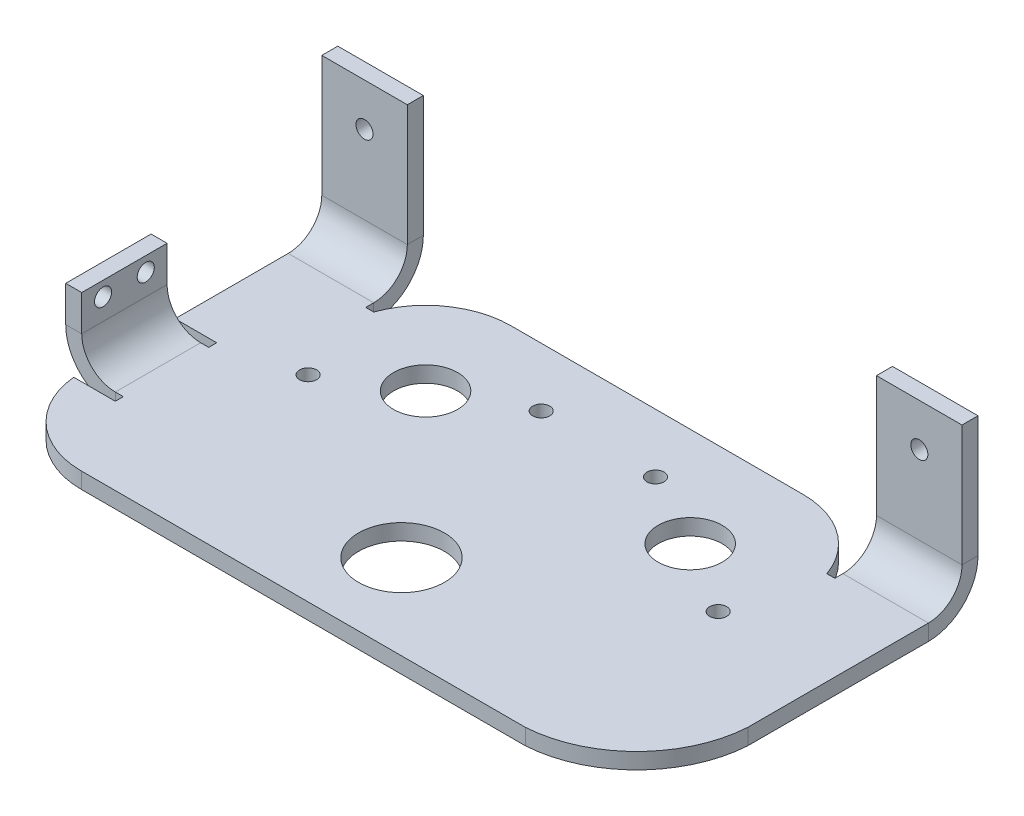
from build123d import *

# Parameters (mm, degrees)
SKETCH1_W                     = 190.5
SKETCH1_H                     = 101.6
BOSS_EXTRUDE1_DEPTH           = 1.5875
CONVERT_SOLID1_START          = -95.25
CONVERT_SOLID1_OUTLINE_W      = 3.175
CONVERT_SOLID1_OUTLINE_H      = 101.6
CONVERT_SOLID1_DEPTH          = 190.5
SKETCH30_R                    = 12.770921212
CUT_EXTRUDE6_DEPTH            = 38.1
SKETCH35_W                    = 139.601875342
SKETCH35_H                    = 6.35
CUT_EXTRUDE7_DEPTH            = 0.254
EDGE_FLANGE1_STRIP_W          = 39.05
EDGE_FLANGE1_STRIP_H          = 4.7625
EDGE_FLANGE1_STRIP_CUT_DEPTH  = 25.449062329
EDGE_FLANGE1_RELIEF_W         = 41.43125
EDGE_FLANGE1_RELIEF_H         = 2.38125
EDGE_FLANGE1_RELIEF_CUT_DEPTH = 4.7625
EDGE_FLANGE1_DEPTH            = 25.449062329
EDGE_FLANGE2_STRIP_W          = 39.05
EDGE_FLANGE2_STRIP_H          = 4.7625
EDGE_FLANGE2_STRIP_CUT_DEPTH  = 25.449062329
EDGE_FLANGE2_RELIEF_W         = 41.43125
EDGE_FLANGE2_RELIEF_H         = 2.38125
EDGE_FLANGE2_RELIEF_CUT_DEPTH = 4.7625
EDGE_FLANGE2_DEPTH            = 25.449062329
SKETCH45_W                    = 4.7625
SKETCH45_H                    = 0.000254
CUT_EXTRUDE10_DEPTH           = 25.4
EDGE_FLANGE4_STRIP_W          = 39.05
EDGE_FLANGE4_STRIP_H          = 4.7625
EDGE_FLANGE4_STRIP_CUT_DEPTH  = 25.4
EDGE_FLANGE4_RELIEF_W         = 41.43125
EDGE_FLANGE4_RELIEF_H         = 2.38125
EDGE_FLANGE4_RELIEF_CUT_DEPTH = 4.7625
EDGE_FLANGE4_DEPTH            = 25.4
FILLET9_R                     = 25.4
CUT_EXTRUDE11_DEPTH           = 25.4
FILLET10_R                    = 25.4
SKETCH53_R                    = 2.54
CUT_EXTRUDE12_DEPTH           = 4.7625
SKETCH54_R                    = 2.54
CUT_EXTRUDE13_DEPTH           = 4.7625
SKETCH55_R                    = 9.525
SKETCH55_R_2                  = 2.54
CUT_EXTRUDE14_DEPTH           = 4.7625


# Read off the part's stored shape, not the designer's step: Convert-Solid1
# Sheet-metal steps are written as plain solids
with BuildPart() as part:
    # Sketch1 → Boss-Extrude1 (new body)
    with BuildSketch(Plane(origin=(0, 0, 0), x_dir=(1, 0, 0), z_dir=(0, 1, 0))):
        Rectangle(SKETCH1_W, SKETCH1_H)
    extrude(amount=BOSS_EXTRUDE1_DEPTH)

    # Convert-Solid1 outline → Convert-Solid1 (add)
    with BuildSketch(Plane.YZ.offset(CONVERT_SOLID1_START)):
        with Locations((-1.5875, 0)):
            Rectangle(CONVERT_SOLID1_OUTLINE_W, CONVERT_SOLID1_OUTLINE_H)
    extrude(amount=CONVERT_SOLID1_DEPTH)

    # Sketch30 → Cut-Extrude6 (cut)
    with BuildSketch(Plane(origin=(0, -3.175, 0), x_dir=(-1, 0, 0), z_dir=(0, -1, 0))):
        with Locations(Location((0, -25.504506424, 0), (0, 0, 90))):
            Circle(SKETCH30_R)
    extrude(amount=-CUT_EXTRUDE6_DEPTH, mode=Mode.SUBTRACT)

    # Sketch35 → Cut-Extrude7 (cut)
    with BuildSketch(Plane(origin=(0, 0, -50.8), x_dir=(-1, 0, 0), z_dir=(0, 0, -1))):
        Rectangle(SKETCH35_W, SKETCH35_H)
    extrude(amount=-CUT_EXTRUDE7_DEPTH, mode=Mode.SUBTRACT)

    # Edge-Flange1 strip (across the edge) → Edge-Flange1 strip cut (cut)
    with BuildSketch(Plane(origin=(95.25, 1.5875, -50.8), x_dir=(0, 0, 1), z_dir=(-1, 0, 0))):
        with Locations((-4.7625, -2.38125)):
            Rectangle(EDGE_FLANGE1_STRIP_W, EDGE_FLANGE1_STRIP_H)
    extrude(amount=EDGE_FLANGE1_STRIP_CUT_DEPTH, mode=Mode.SUBTRACT)

    # Edge-Flange1 relief (on the sheet) → Edge-Flange1 relief cut (cut)
    with BuildSketch(Plane(origin=(95.25, 1.5875, -36.0375), x_dir=(0, 0, 1), z_dir=(0, 1, 0))):
        with Locations((-18.334375, -26.639687329)):
            Rectangle(EDGE_FLANGE1_RELIEF_W, EDGE_FLANGE1_RELIEF_H)
    extrude(amount=-EDGE_FLANGE1_RELIEF_CUT_DEPTH, mode=Mode.SUBTRACT)

    # Edge-Flange1 section (across the edge) → Edge-Flange1 (add)
    with BuildSketch(Plane(origin=(95.25, 1.5875, -50.8), x_dir=(0, 0, 1), z_dir=(-1, 0, 0))):
        with BuildLine():
            Line((0, 10), (0, 46.0375))
            Line((0, 46.0375), (4.7625, 46.0375))
            Line((4.7625, 46.0375), (4.7625, 10))
            ThreePointArc((4.7625, 10), (7.691432188, 2.928932188), (14.7625, 0))
            Line((14.7625, 0), (14.7625, -4.7625))
            ThreePointArc((14.7625, -4.7625), (4.323836143, -0.438663857), (0, 10))
        make_face()
    extrude(amount=EDGE_FLANGE1_DEPTH)

    # Edge-Flange2 strip (across the edge) → Edge-Flange2 strip cut (cut)
    with BuildSketch(Plane(origin=(-69.800937671, 1.5875, -50.8), x_dir=(0, 0, 1), z_dir=(-1, 0, 0))):
        with Locations((-4.7625, -2.38125)):
            Rectangle(EDGE_FLANGE2_STRIP_W, EDGE_FLANGE2_STRIP_H)
    extrude(amount=EDGE_FLANGE2_STRIP_CUT_DEPTH, mode=Mode.SUBTRACT)

    # Edge-Flange2 relief (on the sheet) → Edge-Flange2 relief cut (cut)
    with BuildSketch(Plane(origin=(-69.800937671, 1.5875, -36.0375), x_dir=(0, 0, 1), z_dir=(0, 1, 0))):
        with Locations((-18.334375, 1.190625)):
            Rectangle(EDGE_FLANGE2_RELIEF_W, EDGE_FLANGE2_RELIEF_H)
    extrude(amount=-EDGE_FLANGE2_RELIEF_CUT_DEPTH, mode=Mode.SUBTRACT)

    # Edge-Flange2 section (across the edge) → Edge-Flange2 (add)
    with BuildSketch(Plane(origin=(-69.800937671, 1.5875, -50.8), x_dir=(0, 0, 1), z_dir=(-1, 0, 0))):
        with BuildLine():
            Line((0, 10), (0, 46.0375))
            Line((0, 46.0375), (4.7625, 46.0375))
            Line((4.7625, 46.0375), (4.7625, 10))
            ThreePointArc((4.7625, 10), (7.691432188, 2.928932188), (14.7625, 0))
            Line((14.7625, 0), (14.7625, -4.7625))
            ThreePointArc((14.7625, -4.7625), (4.323836143, -0.438663857), (0, 10))
        make_face()
    extrude(amount=EDGE_FLANGE2_DEPTH)

    # Sketch45 → Cut-Extrude10 (cut)
    with BuildSketch(Plane(origin=(0, 1.5875, 0), x_dir=(1, 0, 0), z_dir=(0, 1, 0))):
        with Locations((-92.86875, -25.399873)):
            Rectangle(SKETCH45_W, SKETCH45_H)
        with Locations((-92.86875, 0.000381)):
            Rectangle(SKETCH45_W, SKETCH45_H)
    extrude(amount=-CUT_EXTRUDE10_DEPTH, mode=Mode.SUBTRACT)

    # Edge-Flange4 strip (across the edge) → Edge-Flange4 strip cut (cut)
    with BuildSketch(Plane(origin=(-95.25, 1.5875, -0.000254), x_dir=(1, 0, 0), z_dir=(0, 0, 1))):
        with Locations((-9.525, -2.38125)):
            Rectangle(EDGE_FLANGE4_STRIP_W, EDGE_FLANGE4_STRIP_H)
    extrude(amount=EDGE_FLANGE4_STRIP_CUT_DEPTH, mode=Mode.SUBTRACT)

    # Edge-Flange4 relief (on the sheet) → Edge-Flange4 relief cut (cut)
    with BuildSketch(Plane(origin=(-85.25, 1.5875, -0.000254), x_dir=(1, 0, 0), z_dir=(0, 1, 0))):
        with Locations((-18.334375, 1.190625)):
            Rectangle(EDGE_FLANGE4_RELIEF_W, EDGE_FLANGE4_RELIEF_H)
        with Locations((-18.334375, -26.590625)):
            Rectangle(EDGE_FLANGE4_RELIEF_W, EDGE_FLANGE4_RELIEF_H)
    extrude(amount=-EDGE_FLANGE4_RELIEF_CUT_DEPTH, mode=Mode.SUBTRACT)

    # Edge-Flange4 section (across the edge) → Edge-Flange4 (add)
    with BuildSketch(Plane(origin=(-95.25, 1.5875, -0.000254), x_dir=(1, 0, 0), z_dir=(0, 0, 1))):
        with BuildLine():
            Line((-4.7625, 10), (-4.7625, 20.6375))
            Line((-4.7625, 20.6375), (0, 20.6375))
            Line((0, 20.6375), (0, 10))
            ThreePointArc((0, 10), (2.928932188, 2.928932188), (10, 0))
            Line((10, 0), (10, -4.7625))
            ThreePointArc((10, -4.7625), (-0.438663857, -0.438663857), (-4.7625, 10))
        make_face()
    extrude(amount=EDGE_FLANGE4_DEPTH)

    # Fillet9
    # the kernel refuses this fillet: 25.4 mm, written as the material it takes off along each edge
    with BuildSketch(Plane(origin=(-67.419687671, 61.417239936, -50.546), x_dir=(1, 0, 0), z_dir=(0, -1, 0))) as fillet9_piece_1:
        with BuildLine():
            CenterArc((23.931895975, 25.4), FILLET9_R, 199.575530564, 70.424469436)
            Line((0, 16.88975), (-0.478637919, 16.719545))
            ThreePointArc((-0.478637919, 16.719545), (-0.508, 8.444875), (-0.508, 0))
            Line((-0.508, 0), (0, -0.508))
            Line((0, -0.508), (23.931895975, -0.508))
            Line((23.931895975, -0.508), (23.931895975, 0))
        make_face()
    extrude(amount=124.421979873, mode=Mode.SUBTRACT)
    with BuildSketch(Plane(origin=(67.419687671, 61.417239936, -50.546), x_dir=(0, 0, 1), z_dir=(0, -1, 0))) as fillet9_piece_2:
        with BuildLine():
            CenterArc((25.4, 23.931895975), FILLET9_R, 180, 70.424469436)
            Line((0, 23.931895975), (-0.508, 23.931895975))
            Line((-0.508, 23.931895975), (-0.508, 0))
            Line((-0.508, 0), (0, -0.508))
            ThreePointArc((0, -0.508), (8.444875, -0.508), (16.719545, -0.478637919))
            Line((16.719545, -0.478637919), (16.88975, 0))
        make_face()
    extrude(amount=124.421979873, mode=Mode.SUBTRACT)

    # Sketch52 → Cut-Extrude11 (cut)
    with BuildSketch(Plane.XZ.offset(3.175)):
        with BuildLine():
            ThreePointArc((62.156767956, 50.8), (84.936935051, 40.486935051), (95.25, 17.706767956))
            Line((95.25, 17.706767956), (95.25, 50.8))
            Line((95.25, 50.8), (62.156767956, 50.8))
        make_face()
    extrude(amount=-CUT_EXTRUDE11_DEPTH, mode=Mode.SUBTRACT)

    # Fillet10
    # the kernel refuses this fillet: 25.4 mm, written as the material it takes off along each edge
    with BuildSketch(Plane(origin=(-95.25, 64.807891195, 50.8), x_dir=(1, 0, 0), z_dir=(0, -1, 0))) as fillet10_piece_1:
        with BuildLine():
            CenterArc((25.288156478, -25.4), FILLET10_R, 90, 84.621196501)
            Line((0, -23.019004), (-0.50576313, -22.97138408))
            ThreePointArc((-0.50576313, -22.97138408), (-0.508, -11.509502), (-0.508, 0))
            Line((-0.508, 0), (0, 0.508))
            Line((0, 0.508), (25.288156478, 0.508))
            Line((25.288156478, 0.508), (25.288156478, 0))
        make_face()
    extrude(amount=131.203282389, mode=Mode.SUBTRACT)

    # Sketch53 → Cut-Extrude12 (cut)
    with BuildSketch(Plane.ZY.offset(100.0125)):
        with Locations(Location((6.349746, 17.9375, 0), (0, 0, 270))):
            Circle(SKETCH53_R)
        with Locations(Location((19.049746, 17.9375, 0), (0, 0, 270))):
            Circle(SKETCH53_R)
    extrude(amount=-CUT_EXTRUDE12_DEPTH, mode=Mode.SUBTRACT)

    # Sketch54 → Cut-Extrude13 (cut)
    with BuildSketch(Plane(origin=(0, 0, -50.8), x_dir=(-1, 0, 0), z_dir=(0, 0, -1))):
        with Locations(Location((-82.55, 34.925, 0), (0, 0, 90))):
            Circle(SKETCH54_R)
        with Locations(Location((82.55, 34.925, 0), (0, 0, 90))):
            Circle(SKETCH54_R)
    extrude(amount=-CUT_EXTRUDE13_DEPTH, mode=Mode.SUBTRACT)

    # Sketch55 → Cut-Extrude14 (cut)
    with BuildSketch(Plane.XZ.offset(3.175)):
        with Locations(Location((-39.37, -21.037138368, 0), (0, 0, 270))):
            Circle(SKETCH55_R)
        with Locations(Location((39.37, -21.037138368, 0), (0, 0, 270))):
            Circle(SKETCH55_R)
        with Locations(Location((-17.001810213, -33.071426284, 0), (0, 0, 270))):
            Circle(SKETCH55_R_2)
        with Locations(Location((-61.002047674, -7.724944205, 0), (0, 0, 270))):
            Circle(SKETCH55_R_2)
        with Locations(Location((61.002047674, -7.724944205, 0), (0, 0, 270))):
            Circle(SKETCH55_R_2)
        with Locations(Location((17.001810213, -33.071426284, 0), (0, 0, 270))):
            Circle(SKETCH55_R_2)
    extrude(amount=-CUT_EXTRUDE14_DEPTH, mode=Mode.SUBTRACT)


solid = part.part
